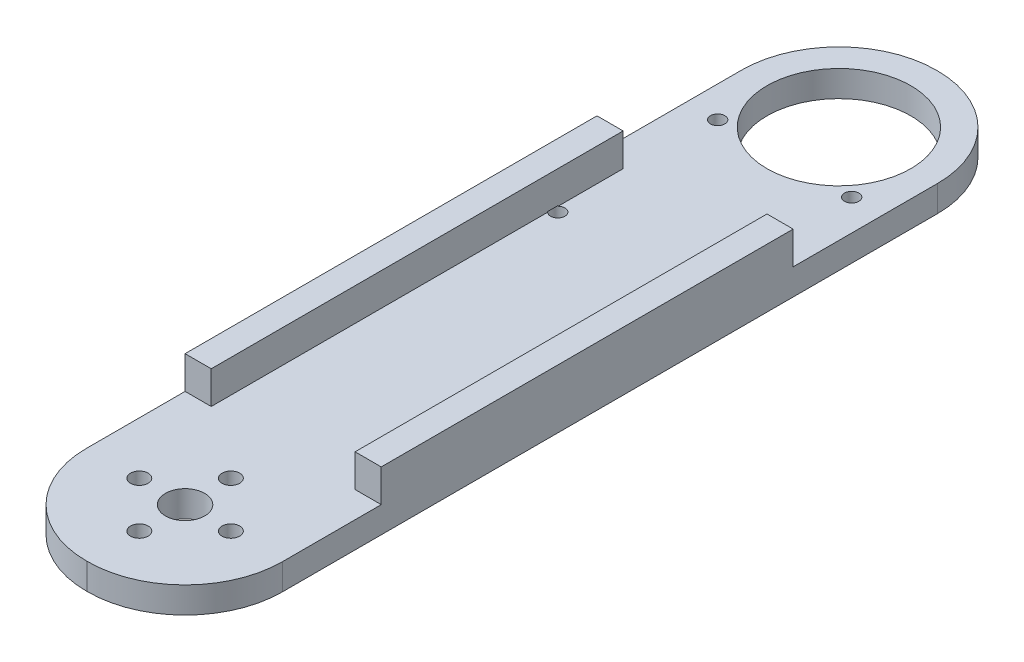
from build123d import *

# Parameters (mm, degrees)
BOSS_1_DEPTH  = 4
S_BOX2_W      = 4
S_BOX2_H      = 5.5
BOSS_2_DEPTH  = 63
S_BOX3_W      = 4
S_BOX3_H      = 5.5
BOSS_3_DEPTH  = 63
S_HOLE4_R     = 3
HOLE_4_DEPTH  = 4.2
S_HOLE5_R     = 1.35
HOLE_5_DEPTH  = 4.2
S_HOLE6_R     = 1.35
HOLE_6_DEPTH  = 4.2
S_HOLE7_R     = 1.35
HOLE_7_DEPTH  = 4.2
S_HOLE8_R     = 1.35
HOLE_8_DEPTH  = 4.2
S_HOLE9_R     = 11
HOLE_9_DEPTH  = 4.2
S_HOLE10_R    = 1.1
HOLE_10_DEPTH = 4.2
S_HOLE11_R    = 1.1
HOLE_11_DEPTH = 4.2
S_HOLE12_R    = 1.1
HOLE_12_DEPTH = 4.2
S_HOLE13_R    = 1.1
HOLE_13_DEPTH = 4.2


with BuildPart() as part:
    # S_prism1 → Boss_1 (new body)
    with BuildSketch(Plane(origin=(0, 16, 0), x_dir=(1, 0, 0), z_dir=(0, 1, 0))):
        with BuildLine():
            Line((-0.1, -15), (0.1, -15))
            ThreePointArc((0.1, -15), (10.6359, -10.6359), (15, -0.1))
            Line((15, -0.1), (15, 100.1))
            ThreePointArc((15, 100.1), (10.6359, 110.6359), (0.1, 115))
            Line((0.1, 115), (-0.1, 115))
            ThreePointArc((-0.1, 115), (-10.6359, 110.6359), (-15, 100.1))
            Line((-15, 100.1), (-15, -0.1))
            ThreePointArc((-15, -0.1), (-10.6359, -10.6359), (-0.1, -15))
        make_face()
    extrude(amount=BOSS_1_DEPTH)

    # S_box2 → Boss_2 (add)
    with BuildSketch(Plane.XY.offset(-78)):
        with Locations((-13, 22.25)):
            Rectangle(S_BOX2_W, S_BOX2_H)
    extrude(amount=BOSS_2_DEPTH)

    # S_box3 → Boss_3 (add)
    with BuildSketch(Plane.XY.offset(-78)):
        with Locations((13, 22.25)):
            Rectangle(S_BOX3_W, S_BOX3_H)
    extrude(amount=BOSS_3_DEPTH)

    # S_hole4 → Hole_4 (cut)
    with BuildSketch(Plane(origin=(0, 15.9, 0), x_dir=(1, 0, 0), z_dir=(0, 1, 0))):
        Circle(S_HOLE4_R)
    extrude(amount=HOLE_4_DEPTH, mode=Mode.SUBTRACT)

    # S_hole5 → Hole_5 (cut)
    with BuildSketch(Plane(origin=(0, 15.9, 0), x_dir=(1, 0, 0), z_dir=(0, 1, 0))):
        with Locations((7, 0)):
            Circle(S_HOLE5_R)
    extrude(amount=HOLE_5_DEPTH, mode=Mode.SUBTRACT)

    # S_hole6 → Hole_6 (cut)
    with BuildSketch(Plane(origin=(0, 15.9, 0), x_dir=(1, 0, 0), z_dir=(0, 1, 0))):
        with Locations((0, -7)):
            Circle(S_HOLE6_R)
    extrude(amount=HOLE_6_DEPTH, mode=Mode.SUBTRACT)

    # S_hole7 → Hole_7 (cut)
    with BuildSketch(Plane(origin=(0, 15.9, 0), x_dir=(1, 0, 0), z_dir=(0, 1, 0))):
        with Locations((-7, 0)):
            Circle(S_HOLE7_R)
    extrude(amount=HOLE_7_DEPTH, mode=Mode.SUBTRACT)

    # S_hole8 → Hole_8 (cut)
    with BuildSketch(Plane(origin=(0, 15.9, 0), x_dir=(1, 0, 0), z_dir=(0, 1, 0))):
        with Locations((0, 7)):
            Circle(S_HOLE8_R)
    extrude(amount=HOLE_8_DEPTH, mode=Mode.SUBTRACT)

    # S_hole9 → Hole_9 (cut)
    with BuildSketch(Plane(origin=(0, 15.9, 0), x_dir=(1, 0, 0), z_dir=(0, 1, 0))):
        with Locations((0, 100)):
            Circle(S_HOLE9_R)
    extrude(amount=HOLE_9_DEPTH, mode=Mode.SUBTRACT)

    # S_hole10 → Hole_10 (cut)
    with BuildSketch(Plane(origin=(0, 15.9, 0), x_dir=(1, 0, 0), z_dir=(0, 1, 0))):
        with Locations((-10.25, 91.7)):
            Circle(S_HOLE10_R)
    extrude(amount=HOLE_10_DEPTH, mode=Mode.SUBTRACT)

    # S_hole11 → Hole_11 (cut)
    with BuildSketch(Plane(origin=(0, 15.9, 0), x_dir=(1, 0, 0), z_dir=(0, 1, 0))):
        with Locations((10.25, 91.7)):
            Circle(S_HOLE11_R)
    extrude(amount=HOLE_11_DEPTH, mode=Mode.SUBTRACT)

    # S_hole12 → Hole_12 (cut)
    with BuildSketch(Plane(origin=(0, 15.9, 0), x_dir=(1, 0, 0), z_dir=(0, 1, 0))):
        with Locations((-10.25, 67.25)):
            Circle(S_HOLE12_R)
    extrude(amount=HOLE_12_DEPTH, mode=Mode.SUBTRACT)

    # S_hole13 → Hole_13 (cut)
    with BuildSketch(Plane(origin=(0, 15.9, 0), x_dir=(1, 0, 0), z_dir=(0, 1, 0))):
        with Locations((10.25, 67.25)):
            Circle(S_HOLE13_R)
    extrude(amount=HOLE_13_DEPTH, mode=Mode.SUBTRACT)


solid = part.part
